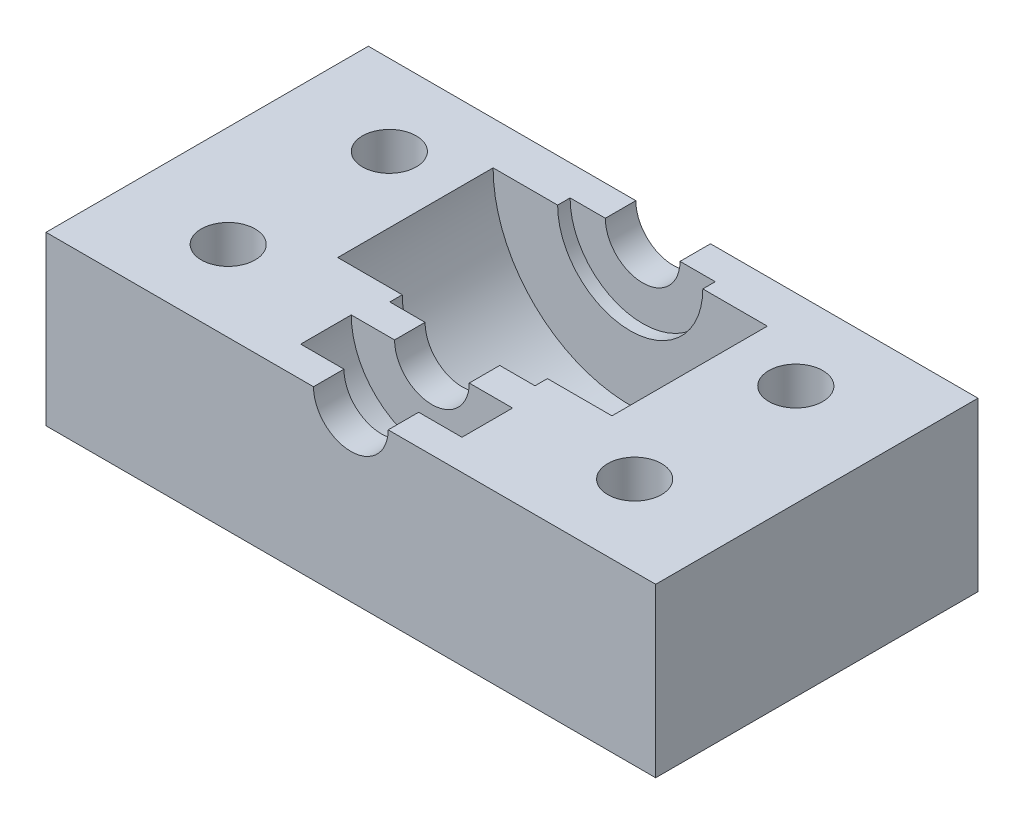
from build123d import *

# Parameters (mm, degrees)
BASE_BOSS_EXTRUDE_DEPTH = 16.49375
M5_CLEARANCE_HOLE2_D    = 5.3


with BuildPart() as part:
    # Lead Screw Pillow Block Sketch → Base Boss-Extrude (new body)
    with BuildSketch(Plane(origin=(0, 0, 0), x_dir=(1, 0, 0), z_dir=(0, 1, 0))):
        Polygon((30, 15.86015), (0, 15.86015), (0, 12.86015), (0, 11.6346), (0, -3.6562), (0, -4.88175), (0, -7.88175), (0, -12.86015), (0, -15.86015), (30, -15.86015), align=None)
    base_boss_extrude = extrude(amount=-BASE_BOSS_EXTRUDE_DEPTH)

    # Lead Screw Pillow Block Sketch<4> → Pillow Cut-Revolve (revolve, cut)
    with BuildSketch(Plane(origin=(0, 0, 0), x_dir=(1, 0, 0), z_dir=(0, 1, 0))):
        Polygon((0, 15.86015), (-3.675, 15.86015), (-3.675, 12.86015), (-7.14375, 12.86015), (-7.14375, 11.6346), (-13.49375, 11.6346), (-13.49375, -3.6562), (-7.14375, -3.6562), (-7.14375, -4.88175), (-3.675, -4.88175), (-3.675, -7.88175), (-7.9375, -7.88175), (-7.9375, -12.86015), (-3.675, -12.86015), (-3.675, -15.86015), (0, -15.86015), align=None)
    pillow_cut_revolve = revolve(axis=Axis((0, 0, -15.86015), (0, 0, 1)), mode=Mode.SUBTRACT)

    # M5 Clearance Hole2 (through all)
    with Locations(Plane(origin=(0, -16.49375, 0), x_dir=(-1, 0, 0), z_dir=(0, -1, 0))):
        with Locations((-20, 7.930075), (-20, -7.930075)):
            m5_clearance_hole2 = Hole(M5_CLEARANCE_HOLE2_D / 2)

    # Mirror1: Base Boss-Extrude, Pillow Cut-Revolve, M5 Clearance Hole2 across plane
    add(base_boss_extrude.mirror(Plane(origin=(0, 0, 0), x_dir=(0, 0, 1), z_dir=(1, 0, 0))))
    add(pillow_cut_revolve.mirror(Plane(origin=(0, 0, 0), x_dir=(0, 0, 1), z_dir=(1, 0, 0))), mode=Mode.SUBTRACT)
    add(m5_clearance_hole2.mirror(Plane(origin=(0, 0, 0), x_dir=(0, 0, 1), z_dir=(1, 0, 0))), mode=Mode.SUBTRACT)


solid = part.part
